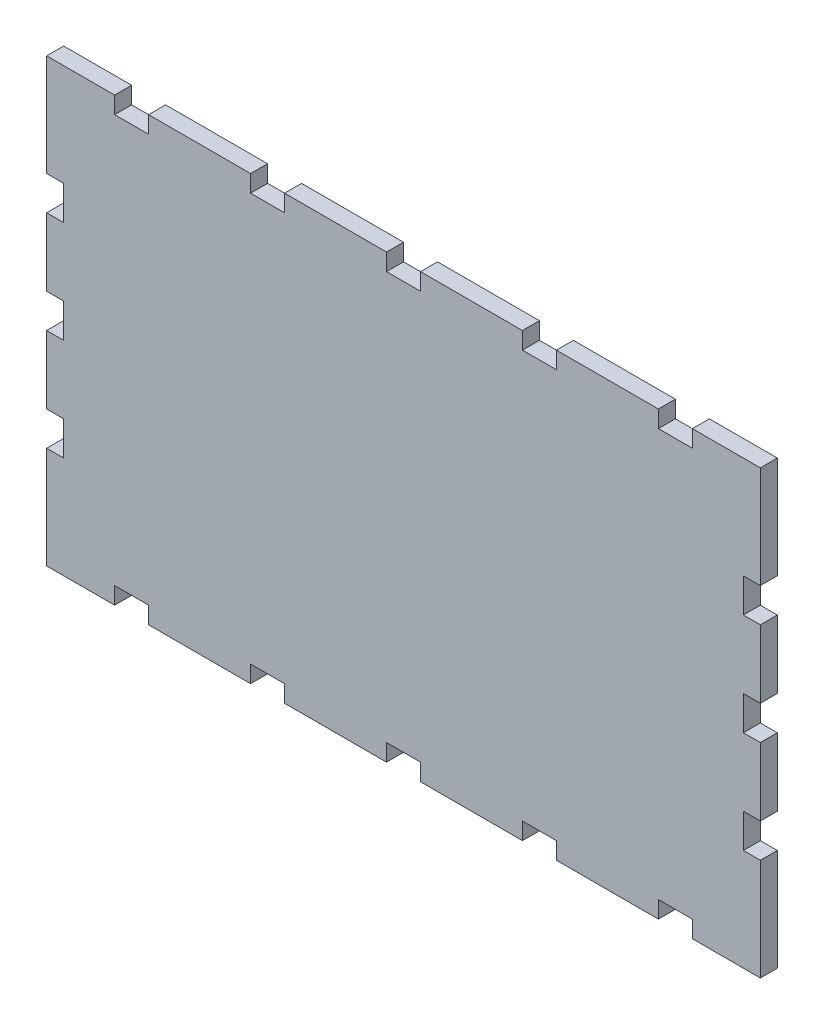
from build123d import *

# Parameters (mm, degrees)
BOSS_EXTRUDE1_DEPTH = 5


with BuildPart() as part:
    # Sketch1 → Boss-Extrude1 (new body)
    with BuildSketch(Plane.XY):
        Polygon((-85, 65), (-85, 60), (-75, 60), (-75, 65), (-45, 65), (-45, 60), (-35, 60), (-35, 65), (-5, 65), (-5, 60), (5, 60), (5, 65), (35, 65), (35, 60), (45, 60), (45, 65), (75, 65), (75, 60), (85, 60), (85, 65), (105, 65), (105, 35), (100, 35), (100, 25), (105, 25), (105, 5), (100, 5), (100, -5), (105, -5), (105, -25), (100, -25), (100, -35), (105, -35), (105, -65), (85, -65), (85, -60), (75, -60), (75, -65), (45, -65), (45, -60), (35, -60), (35, -65), (5, -65), (5, -60), (-5, -60), (-5, -65), (-35, -65), (-35, -60), (-45, -60), (-45, -65), (-75, -65), (-75, -60), (-85, -60), (-85, -65), (-105, -65), (-105, -35), (-100, -35), (-100, -25), (-105, -25), (-105, -5), (-100, -5), (-100, 5), (-105, 5), (-105, 25), (-100, 25), (-100, 35), (-105, 35), (-105, 65), align=None)
    extrude(amount=BOSS_EXTRUDE1_DEPTH)


solid = part.part
